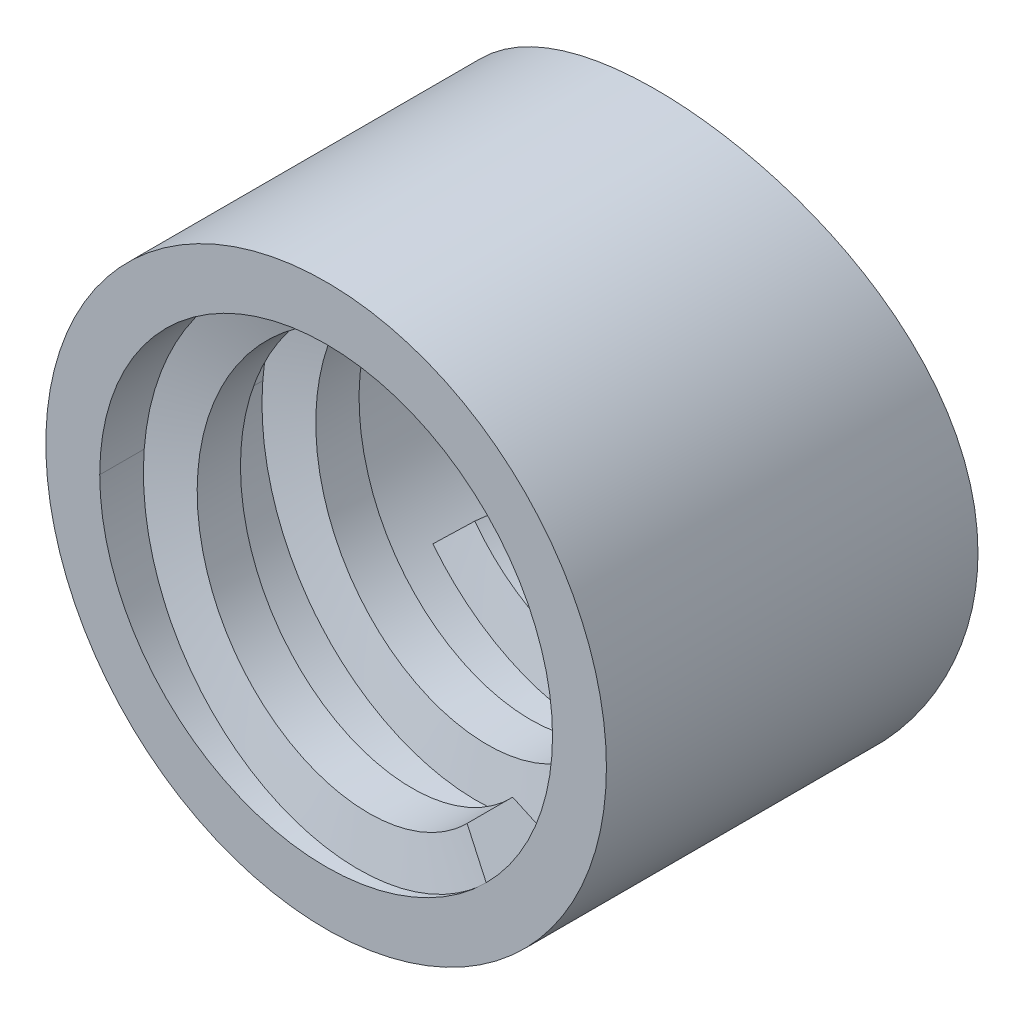
from build123d import *

# Parameters (mm, degrees)
EXTRUDE_1_DEPTH          = 12.375
EXTRUDE_1_DEPTH_BACK     = 13
SKETCH_1_R               = 13
CUT_EXTRUDE_1_DEPTH      = 20
CUT_EXTRUDE_1_DEPTH_BACK = 10
SKETCH_2_R               = 10.5
SWEEP_1_PITCH            = 5.5
CUT_EXTRUDE_2_DEPTH      = 20
CUT_EXTRUDE_2_DEPTH_BACK = 20
SKETCH_6_R               = 45.002821291


with BuildPart() as part:
    # 草图1 → 凸台-拉伸1 (new, two sides: drawn at the far end of the back side and taken through both)
    with BuildSketch(Plane.XY.offset(-EXTRUDE_1_DEPTH_BACK)):
        Circle(SKETCH_1_R)
    extrude(amount=EXTRUDE_1_DEPTH + EXTRUDE_1_DEPTH_BACK)

    # 草图2 → 切除-拉伸1 (cut, two sides: drawn at the far end of the back side and taken through both)
    with BuildSketch(Plane.XY.offset(-CUT_EXTRUDE_1_DEPTH_BACK)):
        Circle(SKETCH_2_R)
    extrude(amount=CUT_EXTRUDE_1_DEPTH + CUT_EXTRUDE_1_DEPTH_BACK, mode=Mode.SUBTRACT)

    # 扫描1: the profile of 草图4 screwed along a right-hand helix of 2.25 turns, 14 arcs to a turn; built about Z, then put on its axis
    sweep_1_z = Axis((0, 0, 0), (0, 0, 1))
    sweep_1_corners = [(10.5, 0, 0), (10.5, 0.249236025, -2.989628974), (8.5, 0.207696687, -2.491357479), (8.5, 0.041539337, -0.498271496)]
    with BuildLine(mode=Mode.PRIVATE) as sweep_1_profile:
        Line(sweep_1_corners[0], sweep_1_corners[1])
        Line(sweep_1_corners[1], sweep_1_corners[2])
        Line(sweep_1_corners[2], sweep_1_corners[3])
        Line(sweep_1_corners[3], sweep_1_corners[0])
    sweep_1_cap = Face(sweep_1_profile.wire())
    sweep_1_turn_angles = [0, 12.857142857, 25.714285714, 38.571428571, 51.428571429, 64.285714286, 77.142857143, 90, 102.857142857, 115.714285714, 128.571428571, 141.428571429, 154.285714286, 167.142857143, 180, 192.857142857, 205.714285714, 218.571428571, 231.428571429, 244.285714286, 257.142857143, 270, 282.857142857, 295.714285714, 308.571428571, 321.428571429, 334.285714286, 347.142857143, 360]
    sweep_1_turn_weights = [1, 0.9749279121818236, 1, 0.9749279121818236, 1, 0.9749279121818236, 1, 0.9749279121818236, 1, 0.9749279121818236, 1, 0.9749279121818236, 1, 0.9749279121818236, 1, 0.9749279121818236, 1, 0.9749279121818236, 1, 0.9749279121818236, 1, 0.9749279121818236, 1, 0.9749279121818237, 1, 0.9749279121818236, 1, 0.9749279121818236, 1]
    sweep_1_turn_rails = [Edge.make_bspline([Vector(p[0], p[1], 0).rotate(sweep_1_z, sweep_1_turn_angles[k]) / sweep_1_turn_weights[k] + Vector(0, 0, p[2] + SWEEP_1_PITCH * sweep_1_turn_angles[k] / 360) for k in range(29)], [0, 0, 0, 1, 1, 2, 2, 3, 3, 4, 4, 5, 5, 6, 6, 7, 7, 8, 8, 9, 9, 10, 10, 11, 11, 12, 12, 13, 13, 14, 14, 14], 2, sweep_1_turn_weights) for p in sweep_1_corners]
    sweep_1_turn_sides = [Face.make_surface_from_curves(sweep_1_turn_rails[p[0]], sweep_1_turn_rails[p[1]]) for p in [(0, 1), (1, 2), (2, 3), (3, 0)]]
    sweep_1_last_angles = [720, 732.857142857, 745.714285714, 758.571428571, 771.428571429, 784.285714286, 797.142857143, 803.571428571, 810]
    sweep_1_last_weights = [1, 0.9749279121818237, 1, 0.9749279121818235, 1, 0.9749279121818237, 1, 0.9937122098932412, 1]
    sweep_1_last_rails = [Edge.make_bspline([Vector(p[0], p[1], 0).rotate(sweep_1_z, sweep_1_last_angles[k]) / sweep_1_last_weights[k] + Vector(0, 0, p[2] + SWEEP_1_PITCH * sweep_1_last_angles[k] / 360) for k in range(9)], [0, 0, 0, 1, 1, 2, 2, 3, 3, 4, 4, 4], 2, sweep_1_last_weights) for p in sweep_1_corners]
    sweep_1_last_sides = [Face.make_surface_from_curves(sweep_1_last_rails[p[0]], sweep_1_last_rails[p[1]]) for p in [(0, 1), (1, 2), (2, 3), (3, 0)]]
    sweep_1 = Plane(origin=(0, 0, 0), x_dir=(-0.7071067811865414, -0.7071067811865537, 0), z_dir=(0, 0, 1)) * Solid(Shell([*[p.moved(Location((0, 0, SWEEP_1_PITCH * i))) for i in range(2) for p in sweep_1_turn_sides], *sweep_1_last_sides, sweep_1_cap, sweep_1_cap.rotate(sweep_1_z, 810).moved(Location((0, 0, SWEEP_1_PITCH * 810 / 360)))]))
    add(sweep_1)

    # 草图6 → 切除-拉伸2 (cut, two sides: drawn at the far end of the back side and taken through both)
    with BuildSketch(Plane(origin=(0, 0, 0), x_dir=(-1, 0, 0), z_dir=(0, -1, 0)).offset(-CUT_EXTRUDE_2_DEPTH_BACK)):
        with Locations((-0.191121104, 48)):
            Circle(SKETCH_6_R)
    extrude(amount=CUT_EXTRUDE_2_DEPTH + CUT_EXTRUDE_2_DEPTH_BACK, mode=Mode.SUBTRACT)


solid = part.part
